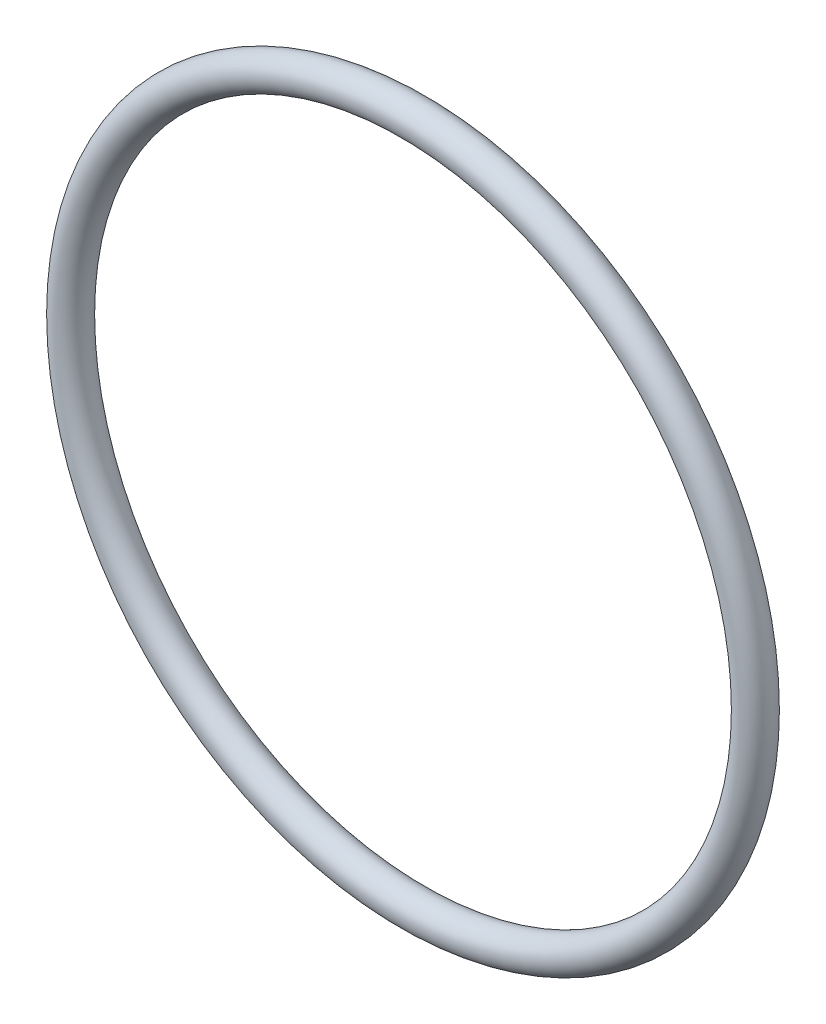
from build123d import *

# Parameters (mm, degrees)
SKETCH3_R   = 50
SKETCH3_R_2 = 35


with BuildPart() as part:
    # Sweep1: sweep along a path in Sketch2
    with BuildLine(Plane.XY) as sweep1_path:
        CenterArc((1008, 0), 1008, 0, 360)
    # Sketch3 → Sweep1 (sweep)
    with BuildSketch(Plane(origin=(0, 0, 0), x_dir=(1, 0, 0), z_dir=(0, 1, 0))):
        Circle(SKETCH3_R)
        Circle(SKETCH3_R_2, mode=Mode.SUBTRACT)
    sweep(path=sweep1_path.line)


solid = part.part
